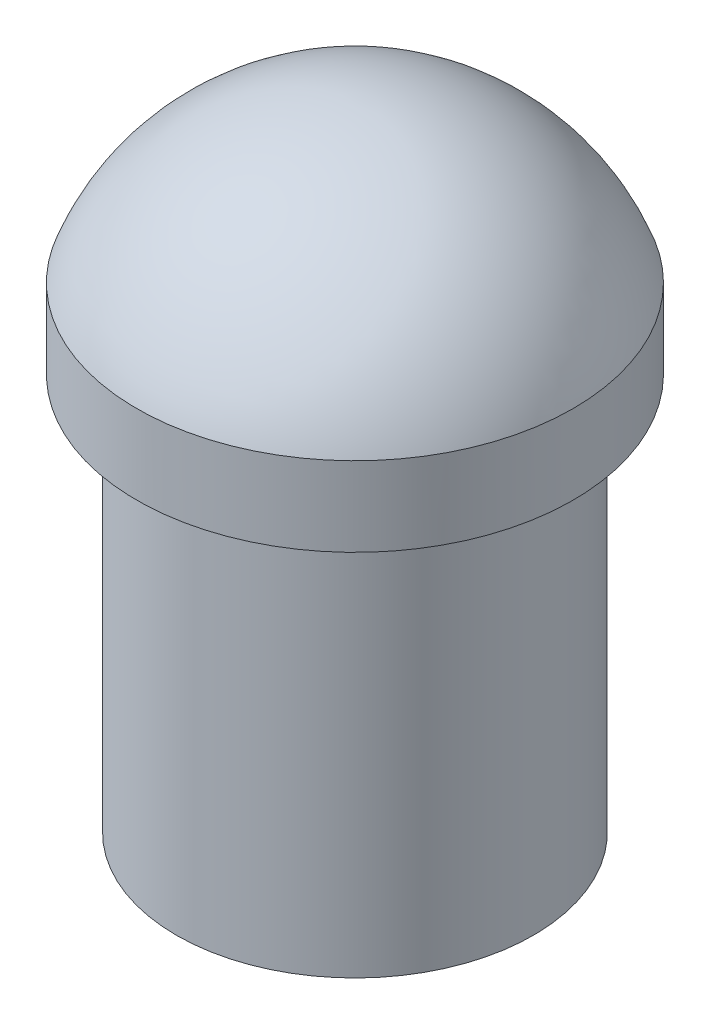
from build123d import *

# Parameters (mm, degrees)
SKETCH1_R           = 2.25
BOSS_EXTRUDE1_DEPTH = 5


with BuildPart() as part:
    # Sketch1 → Boss-Extrude1 (new body)
    with BuildSketch(Plane(origin=(0, 0, 0), x_dir=(1, 0, 0), z_dir=(0, 1, 0))):
        Circle(SKETCH1_R)
    extrude(amount=BOSS_EXTRUDE1_DEPTH)

    # Sketch2 → Revolve1 (revolve)
    with BuildSketch(Plane.XY):
        with BuildLine():
            Line((-2.75, 6), (-2.75, 5))
            Line((-2.75, 5), (0, 5))
            Line((0, 5), (0, 7.926174978))
            ThreePointArc((0, 7.926174978), (-1.678738369, 7.396734756), (-2.75, 6))
        make_face()
    revolve(axis=Axis((0, -2.040480146, 0), (0, 1, 0)))


solid = part.part
